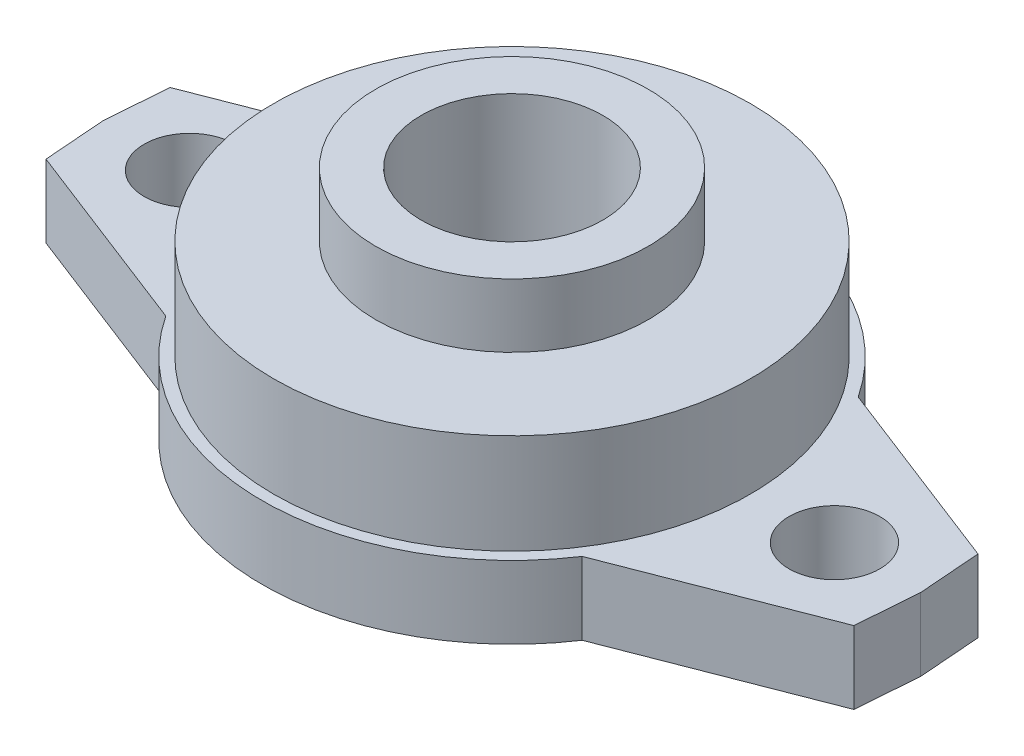
from build123d import *

# Parameters (mm, degrees)
SKETCH1_R               = 27.5
BOSS_EXTRUDE1_DEPTH     = 8
SKETCH2_R               = 26.25
BOSS_EXTRUDE2_DEPTH     = 11
BOSS_EXTRUDE3_DEPTH     = 8
SKETCH4_R               = 5
CUT_EXTRUDE1_DEPTH      = 54.872534746
MIRROR2_OUTLINE_R       = 5
MIRROR2_DEPTH           = 8
SKETCH6_R               = 15
BOSS_EXTRUDE4_DEPTH     = 7
CUT_EXTRUDE2_DEPTH      = 57.055775795
CUT_EXTRUDE2_DEPTH_BACK = 57.055775795
SKETCH5_R               = 10


# Read off the part's stored shape, not the designer's step: Mirror2
with BuildPart() as part:
    # Sketch1 → Boss-Extrude1 (new body)
    with BuildSketch(Plane(origin=(0, 0, 0), x_dir=(1, 0, 0), z_dir=(0, 1, 0))):
        with Locations(Location((0, 0, 0), (0, 0, 270))):
            Circle(SKETCH1_R)
    extrude(amount=BOSS_EXTRUDE1_DEPTH)

    # Sketch2 → Boss-Extrude2 (add)
    with BuildSketch(Plane(origin=(0, 8, 0), x_dir=(1, 0, 0), z_dir=(0, 1, 0))):
        with Locations(Location((0, 0, 0), (0, 0, 270))):
            Circle(SKETCH2_R)
    extrude(amount=BOSS_EXTRUDE2_DEPTH)

    # Sketch3 → Boss-Extrude3 (add)
    with BuildSketch(Plane(origin=(0, 0, 0), x_dir=(1, 0, 0), z_dir=(0, 1, 0))):
        Polygon((20.794342335, 16.0205439), (44.474731406, 6.832149094), (45, 0), (20.794342335, 0), align=None)
    boss_extrude3 = extrude(amount=BOSS_EXTRUDE3_DEPTH)

    # Mirror1: Boss-Extrude3 across plane
    add(boss_extrude3.mirror(Plane.XY))

    # Sketch4 → Cut-Extrude1 (cut, through all)
    with BuildSketch(Plane(origin=(0, 8, 0), x_dir=(1, 0, 0), z_dir=(0, 1, 0))):
        with Locations(Location((35.5, 0, 0), (0, 0, 270))):
            Circle(SKETCH4_R)
    extrude(amount=-CUT_EXTRUDE1_DEPTH, mode=Mode.SUBTRACT)

    # Mirror2 outline → Mirror2 (add)
    with BuildSketch(Plane(origin=(0, 0, 0), x_dir=(1, 0, 0), z_dir=(0, 1, 0))):
        with BuildLine():
            ThreePointArc((-22.9203732, -15.195607667), (-27.5, 0), (-22.9203732, 15.195607667))
            Line((-22.9203732, 15.195607667), (-44.474731406, 6.832149094))
            Line((-44.474731406, 6.832149094), (-45, 0))
            Line((-45, 0), (-44.474731406, -6.832149094))
            Line((-44.474731406, -6.832149094), (-22.9203732, -15.195607667))
        make_face()
        with Locations((-35.5, 0)):
            Circle(MIRROR2_OUTLINE_R, mode=Mode.SUBTRACT)
    extrude(amount=MIRROR2_DEPTH)

    # Sketch6 → Boss-Extrude4 (add)
    with BuildSketch(Plane(origin=(0, 19, 0), x_dir=(1, 0, 0), z_dir=(0, 1, 0))):
        with Locations(Location((0, 0, 0), (0, 0, 270))):
            Circle(SKETCH6_R)
    extrude(amount=BOSS_EXTRUDE4_DEPTH)

    # Sketch5 → Cut-Extrude2 (cut, two sides: drawn at the far end of the back side and taken through both)
    with BuildSketch(Plane(origin=(0, 19, 0), x_dir=(1, 0, 0), z_dir=(0, 1, 0)).offset(-CUT_EXTRUDE2_DEPTH_BACK)):
        with Locations(Location((0, 0, 0), (0, 0, 270))):
            Circle(SKETCH5_R)
    extrude(amount=CUT_EXTRUDE2_DEPTH + CUT_EXTRUDE2_DEPTH_BACK, mode=Mode.SUBTRACT)


solid = part.part
